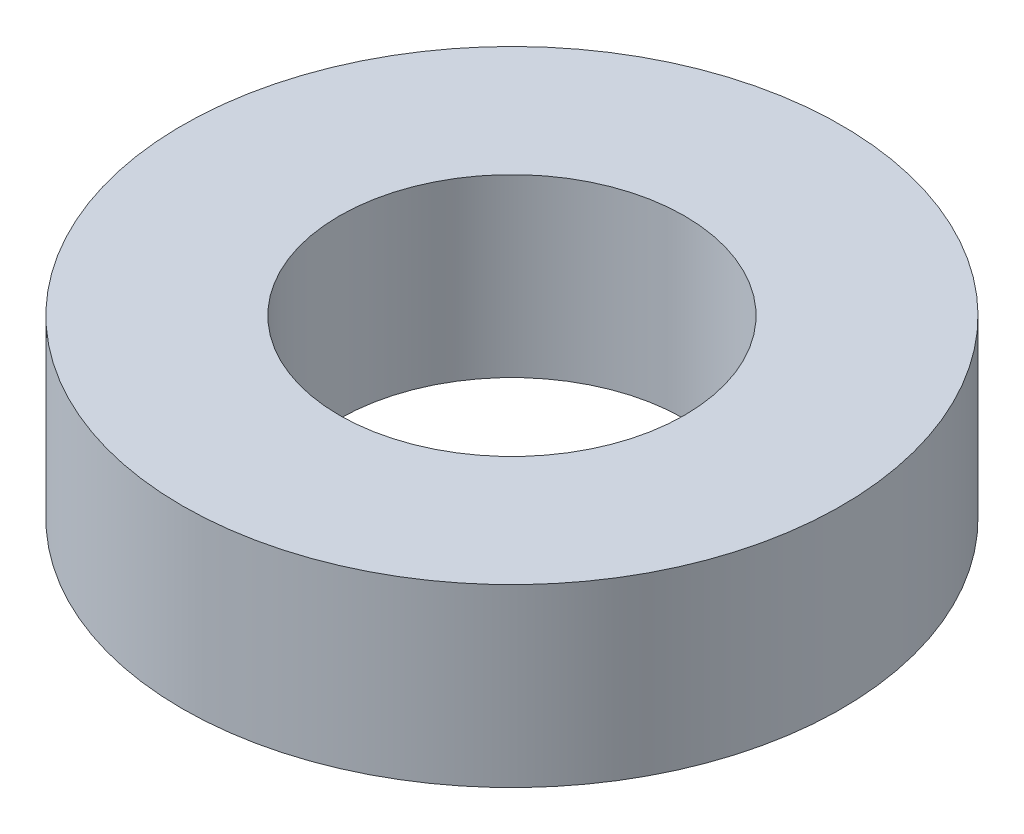
from build123d import *

# Parameters (mm, degrees)
SKETCH1_R           = 52.5
BOSS_EXTRUDE1_DEPTH = 28
SKETCH2_R           = 27.5
CUT_EXTRUDE1_DEPTH  = 80.350488341


with BuildPart() as part:
    # Sketch1 → Boss-Extrude1 (new body)
    with BuildSketch(Plane(origin=(0, 0, 0), x_dir=(1, 0, 0), z_dir=(0, 1, 0))):
        Circle(SKETCH1_R)
    extrude(amount=BOSS_EXTRUDE1_DEPTH)

    # Sketch2 → Cut-Extrude1 (cut, through all)
    with BuildSketch(Plane(origin=(0, 0, 0), x_dir=(1, 0, 0), z_dir=(0, 1, 0))):
        Circle(SKETCH2_R)
    extrude(amount=CUT_EXTRUDE1_DEPTH, mode=Mode.SUBTRACT)


solid = part.part
